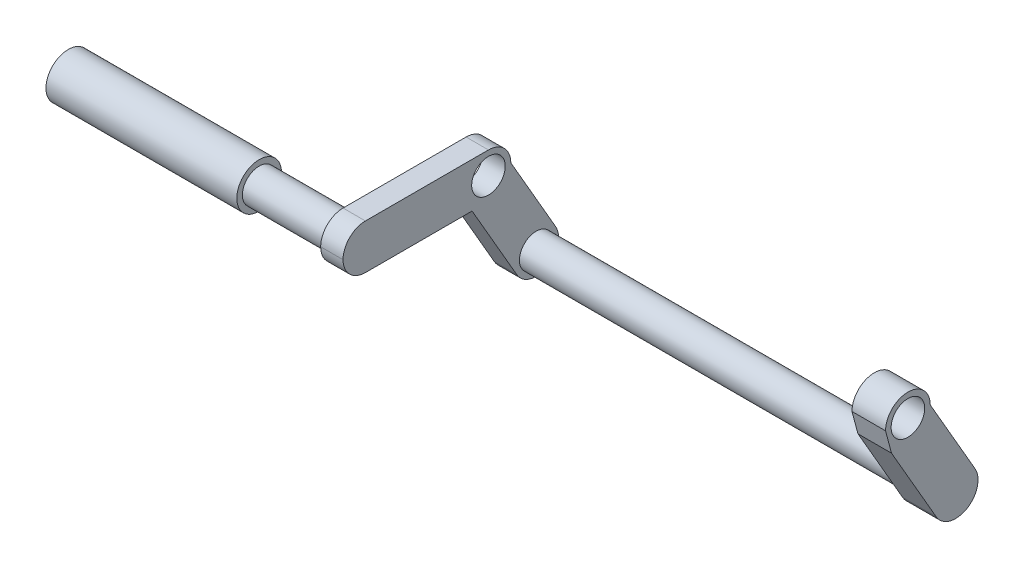
from build123d import *

# Parameters (mm, degrees)
SKETCH2_R                = 2
BOSS_EXTRUDE1_DEPTH      = 17.06
SKETCH3_R                = 1.5
BOSS_EXTRUDE2_DEPTH      = 9.5
SKETCH4_W                = 3.988125856
SKETCH4_H                = 4
BOSS_EXTRUDE3_DEPTH      = 2
SKETCH5_W                = 2
SKETCH5_H                = 4
BOSS_EXTRUDE4_DEPTH      = 15
FILLET1_R                = 2
FILLET2_R                = 2
FILLET3_R                = 2
SKETCH6_R                = 1.5
CUT_EXTRUDE1_DEPTH       = 30.638380523
BOSS_EXTRUDE5_DEPTH      = 2
FILLET4_R                = 2
FILLET5_R                = 2
SKETCH8_R                = 1.5
BOSS_EXTRUDE6_DEPTH      = 36
BOSS_EXTRUDE7_DEPTH      = 1.5
BOSS_EXTRUDE7_DEPTH_BACK = 1.5
SKETCH9_R                = 2
SKETCH9_R_2              = 1.5


with BuildPart() as part:
    # Sketch2 → Boss-Extrude1 (new body)
    with BuildSketch(Plane(origin=(0, 0, 0), x_dir=(0, 0, -1), z_dir=(1, 0, 0))):
        Circle(SKETCH2_R)
    extrude(amount=BOSS_EXTRUDE1_DEPTH)

    # Sketch3 → Boss-Extrude2 (add)
    with BuildSketch(Plane(origin=(17.06, 0, 0), x_dir=(0, 0, -1), z_dir=(1, 0, 0))):
        Circle(SKETCH3_R)
    extrude(amount=BOSS_EXTRUDE2_DEPTH)

    # Sketch4 → Boss-Extrude3 (add)
    with BuildSketch(Plane(origin=(26.56, 0, 0), x_dir=(0, 0, -1), z_dir=(1, 0, 0))):
        with Locations((-0.005937072, 0)):
            Rectangle(SKETCH4_W, SKETCH4_H)
    extrude(amount=-BOSS_EXTRUDE3_DEPTH)

    # Sketch5 → Boss-Extrude4 (add)
    with BuildSketch(Plane.XY.offset(2)):
        with Locations((25.56, 0)):
            Rectangle(SKETCH5_W, SKETCH5_H)
    extrude(amount=-BOSS_EXTRUDE4_DEPTH)

    # Fillet1
    fillet1_edges = [part.edges().sort_by_distance(p)[0] for p in [
        (25.56, 2, 2),
    ]]
    fillet(fillet1_edges, radius=FILLET1_R)

    # Fillet2
    fillet2_edges = [part.edges().sort_by_distance(p)[0] for p in [
        (25.56, -2, 2),
    ]]
    fillet(fillet2_edges, radius=FILLET2_R - 0.0001)  # a hair under: the kernel refuses the full size

    # Fillet3
    fillet3_edges = [part.edges().sort_by_distance(p)[0] for p in [
        (25.56, -2, -13),
        (25.56, 2, -13),
    ]]
    fillet(fillet3_edges, radius=FILLET3_R - 0.0001)  # a hair under: the kernel refuses the full size

    # Sketch6 → Cut-Extrude1 (cut, through all)
    with BuildSketch(Plane(origin=(26.56, 0, 0), x_dir=(0, 0, -1), z_dir=(1, 0, 0))):
        with Locations((11, 0)):
            Circle(SKETCH6_R)
    extrude(amount=-CUT_EXTRUDE1_DEPTH, mode=Mode.SUBTRACT)

    # Sketch7 → Boss-Extrude5 (add)
    with BuildSketch(Plane(origin=(26.56, 0, 0), x_dir=(0, 0, -1), z_dir=(1, 0, 0))):
        with BuildLine():
            Line((18, -8.660254038), (13, 0))
            ThreePointArc((13, 0), (12.414213562, -1.414213562), (11, -2))
            Line((11, -2), (9.535898385, -2))
            Line((9.535898385, -2), (14.535898385, -10.660254038))
            Line((14.535898385, -10.660254038), (18, -8.660254038))
        make_face()
    extrude(amount=-BOSS_EXTRUDE5_DEPTH)

    # Fillet4
    fillet4_edges = [part.edges().sort_by_distance(p)[0] for p in [
        (25.56, -8.660254038, -18),
    ]]
    fillet(fillet4_edges, radius=FILLET4_R)

    # Fillet5
    fillet5_edges = [part.edges().sort_by_distance(p)[0] for p in [
        (25.56, -10.660254038, -14.535898385),
    ]]
    fillet(fillet5_edges, radius=FILLET5_R - 0.0001)  # a hair under: the kernel refuses the full size

    # Sketch8 → Boss-Extrude6 (add)
    with BuildSketch(Plane(origin=(26.56, 0, 0), x_dir=(0, 0, -1), z_dir=(1, 0, 0))):
        with Locations((15.267949192, -7.92820323)):
            Circle(SKETCH8_R)
    extrude(amount=BOSS_EXTRUDE6_DEPTH)

    # Sketch9 → Boss-Extrude7 (add, two sides: drawn at the far end of the back side and taken through both)
    # profile 1 of 4: a face of its own
    with BuildSketch(Plane(origin=(62.56, 0, 0), x_dir=(0, 0, -1), z_dir=(1, 0, 0)).offset(-BOSS_EXTRUDE7_DEPTH_BACK)):
        with Locations((15.267949192, -7.92820323)):
            Circle(SKETCH9_R)
        with Locations((15.267949192, -7.92820323)):
            Circle(SKETCH9_R_2, mode=Mode.SUBTRACT)
    # profile 2 of 4: a face of its own
    with BuildSketch(Plane(origin=(62.56, 0, 0), x_dir=(0, 0, -1), z_dir=(1, 0, 0)).offset(-BOSS_EXTRUDE7_DEPTH_BACK)):
        with BuildLine():
            ThreePointArc((13.535898385, -8.92820323), (14.267949192, -6.196152423), (17, -6.92820323))
            Line((17, -6.92820323), (13, 0))
            ThreePointArc((13, 0), (11.51763809, -1.931851653), (9.267949192, -1))
            Line((9.267949192, -1), (9.535898385, -2))
            Line((9.535898385, -2), (13.535898385, -8.92820323))
        make_face()
    # profile 3 of 4: a face of its own
    with BuildSketch(Plane(origin=(62.56, 0, 0), x_dir=(0, 0, -1), z_dir=(1, 0, 0)).offset(-BOSS_EXTRUDE7_DEPTH_BACK)):
        with BuildLine():
            ThreePointArc((9.267949192, -1), (11.51763809, -1.931851653), (13, 0))
            ThreePointArc((13, 0), (11, 2), (9, 0))
            Line((9, 0), (9.267949192, -1))
        make_face()
        with Locations((11, 0)):
            Circle(SKETCH9_R_2, mode=Mode.SUBTRACT)
    # profile 4 of 4: a face of its own
    with BuildSketch(Plane(origin=(62.56, 0, 0), x_dir=(0, 0, -1), z_dir=(1, 0, 0)).offset(-BOSS_EXTRUDE7_DEPTH_BACK)):
        with Locations((15.267949192, -7.92820323)):
            Circle(SKETCH9_R_2)
    extrude(amount=BOSS_EXTRUDE7_DEPTH + BOSS_EXTRUDE7_DEPTH_BACK)


solid = part.part
